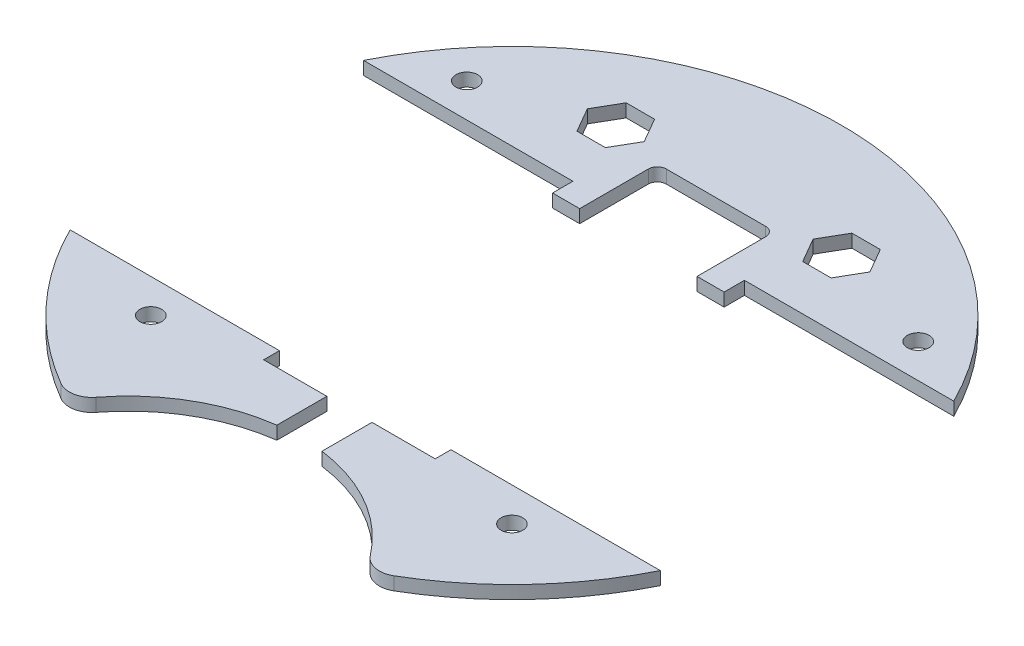
from build123d import *

# Parameters (mm, degrees)
BOSS_EXTRUDE1_DEPTH  = 2.9
SOLENOID_PLACEMENT_W = 38
SOLENOID_PLACEMENT_H = 64
CUT_EXTRUDE1_DEPTH   = 104.278313309
CUT_EXTRUDE4_DEPTH   = 104.278313309
CUT_EXTRUDE5_DEPTH   = 104.278313309
SKETCH6_R            = 2.4
CUT_EXTRUDE6_DEPTH   = 104.278313309
CUT_EXTRUDE3_DEPTH   = 104.278313309
SKETCH7_W            = 10
SKETCH7_H            = 62.80248699
CUT_EXTRUDE7_DEPTH   = 99.031423533


with BuildPart() as part:
    # Sketch1 → Boss-Extrude1 (new body)
    with BuildSketch(Plane(origin=(0, 0, 0), x_dir=(1, 0, 0), z_dir=(0, 1, 0))):
        with BuildLine():
            ThreePointArc((36.856602833, -63.012624351), (0, 73), (-36.856602833, -63.012624351))
            ThreePointArc((-36.856602833, -63.012624351), (-33.368752207, -63.602994345), (-30.363140064, -61.737536127))
            ThreePointArc((-30.363140064, -61.737536127), (0, -46.75), (30.363140064, -61.737536127))
            ThreePointArc((30.363140064, -61.737536127), (33.368752207, -63.602994345), (36.856602833, -63.012624351))
        make_face()
    extrude(amount=BOSS_EXTRUDE1_DEPTH)

    # solenoid placement → Cut-Extrude1 (cut, through all)
    with BuildSketch(Plane(origin=(0, 2.9, 0), x_dir=(1, 0, 0), z_dir=(0, 1, 0))):
        with Locations((0, -4)):
            Rectangle(SOLENOID_PLACEMENT_W, SOLENOID_PLACEMENT_H)
    extrude(amount=-CUT_EXTRUDE1_DEPTH, mode=Mode.SUBTRACT)

    # Sketch4 → Cut-Extrude4 (cut, through all)
    with BuildSketch(Plane(origin=(0, 2.9, 0), x_dir=(1, 0, 0), z_dir=(0, 1, 0))):
        with BuildLine():
            Line((-13, 28), (13, 28))
            Line((13, 28), (13, 43.2))
            ThreePointArc((13, 43.2), (12.414213562, 44.614213562), (11, 45.2))
            Line((11, 45.2), (-11, 45.2))
            ThreePointArc((-11, 45.2), (-12.414213562, 44.614213562), (-13, 43.2))
            Line((-13, 43.2), (-13, 28))
        make_face()
    extrude(amount=-CUT_EXTRUDE4_DEPTH, mode=Mode.SUBTRACT)

    # Sketch5 → Cut-Extrude5 (cut, through all)
    with BuildSketch(Plane(origin=(0, 2.9, 0), x_dir=(1, 0, 0), z_dir=(0, 1, 0))):
        Polygon((-18.706882066, 48), (-21.853441033, 53.45), (-28.146558967, 53.45), (-31.293117934, 48), (-28.146558967, 42.55), (-21.853441033, 42.55), align=None)
        Polygon((18.706882066, 48), (21.853441033, 42.55), (28.146558967, 42.55), (31.293117934, 48), (28.146558967, 53.45), (21.853441033, 53.45), align=None)
    extrude(amount=-CUT_EXTRUDE5_DEPTH, mode=Mode.SUBTRACT)

    # Sketch6 → Cut-Extrude6 (cut, through all)
    with BuildSketch(Plane(origin=(0, 2.9, 0), x_dir=(1, 0, 0), z_dir=(0, 1, 0))):
        with Locations((40, -40)):
            Circle(SKETCH6_R)
        with Locations((-40, -40)):
            Circle(SKETCH6_R)
        with Locations((-50, 40)):
            Circle(SKETCH6_R)
        with Locations((50, 40)):
            Circle(SKETCH6_R)
    extrude(amount=-CUT_EXTRUDE6_DEPTH, mode=Mode.SUBTRACT)

    # Sketch3 → Cut-Extrude3 (cut, through all)
    with BuildSketch(Plane(origin=(0, 2.9, 0), x_dir=(1, 0, 0), z_dir=(0, 1, 0))):
        Polygon((-19, 28), (-19, 32.5), (-73, 32.5), (-73, -32.5), (73, -32.5), (73, 32.5), (19, 32.5), (19, 28), align=None)
    extrude(amount=-CUT_EXTRUDE3_DEPTH, mode=Mode.SUBTRACT)


with BuildPart() as cut_extrude3_piece_1:
    # of the separate pieces the step leaves, piece 1, a body of its own (cut_extrude3_pieces)
    add(part.part.solids().sort_by_distance((65.366275709, 0, -32.5))[0])


with BuildPart() as cut_extrude3_piece_2:
    # of the separate pieces the step leaves, piece 2, a body of its own (cut_extrude3_pieces)
    add(part.part.solids().sort_by_distance((-36.856602833, 0, 63.012624351))[0])

    # Sketch7 → Cut-Extrude7 (cut, through all)
    with BuildSketch(Plane(origin=(0, 2.9, 0), x_dir=(1, 0, 0), z_dir=(0, 1, 0))):
        with Locations((0, -31.401243495)):
            Rectangle(SKETCH7_W, SKETCH7_H)
    extrude(amount=-CUT_EXTRUDE7_DEPTH, mode=Mode.SUBTRACT)


with BuildPart() as cut_extrude7_piece_1:
    # of the separate pieces the step leaves, piece 1, a body of its own (cut_extrude7_pieces)
    add(cut_extrude3_piece_2.part.solids().sort_by_distance((5, 0, 47.078205475))[0])


with BuildPart() as cut_extrude7_piece_2:
    # of the separate pieces the step leaves, piece 2, a body of its own (cut_extrude7_pieces)
    add(cut_extrude3_piece_2.part.solids().sort_by_distance((-36.856602833, 0, 63.012624351))[0])


solid = Compound([cut_extrude3_piece_1.part, cut_extrude7_piece_1.part, cut_extrude7_piece_2.part])
